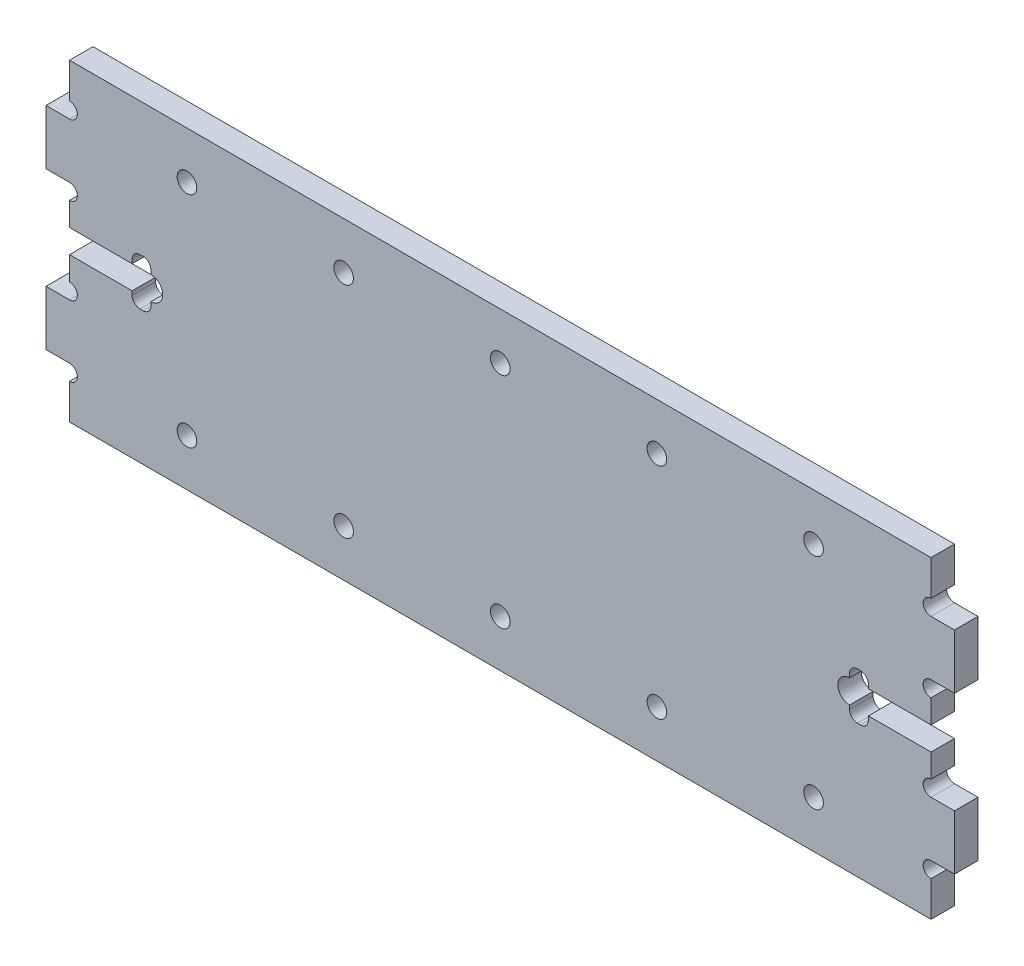
from build123d import *

# Parameters (mm, degrees)
SKETCH1_W           = 110
SKETCH1_H           = 40
BOSS_EXTRUDE1_DEPTH = 3
BOSS_EXTRUDE2_DEPTH = 3
CUT_EXTRUDE1_DEPTH  = 3
CUT_EXTRUDE2_DEPTH  = 3
FILLET6_R           = 1
SKETCH6_R           = 1.25
CUT_EXTRUDE4_DEPTH  = 62.424750712


with BuildPart() as part:
    # Sketch1 → Boss-Extrude1 (new body)
    with BuildSketch(Plane.XY):
        Rectangle(SKETCH1_W, SKETCH1_H)
    extrude(amount=BOSS_EXTRUDE1_DEPTH)

    # Sketch2 → Boss-Extrude2 (add)
    with BuildSketch(Plane.XY.offset(3)):
        Polygon((58, 10), (58, 13.5), (55, 13.5), (55, 6.5), (58, 6.5), align=None)
        Polygon((55, -10), (55, -6.5), (58, -6.5), (58, -13.5), (55, -13.5), align=None)
        Polygon((-55, 6.5), (-55, 13.5), (-58, 13.5), (-58, 10), (-58, 6.5), align=None)
        Polygon((-55, -13.5), (-55, -10), (-55, -6.5), (-58, -6.5), (-58, -13.5), align=None)
    extrude(amount=-BOSS_EXTRUDE2_DEPTH)

    # Sketch3 → Cut-Extrude1 (cut)
    with BuildSketch(Plane.XY.offset(3)):
        with BuildLine():
            Line((-55, 15.5), (-55, 13.5))
            ThreePointArc((-55, 13.5), (-54, 14.5), (-55, 15.5))
        make_face()
        with BuildLine():
            ThreePointArc((-55, 4.5), (-54, 5.5), (-55, 6.5))
            Line((-55, 6.5), (-55, 4.5))
        make_face()
        with BuildLine():
            ThreePointArc((-55, -6.5), (-54, -5.5), (-55, -4.5))
            Line((-55, -4.5), (-55, -6.5))
        make_face()
        with BuildLine():
            ThreePointArc((-55, -15.5), (-54, -14.5), (-55, -13.5))
            Line((-55, -13.5), (-55, -15.5))
        make_face()
        with BuildLine():
            ThreePointArc((55, 15.5), (54, 14.5), (55, 13.5))
            Line((55, 13.5), (55, 15.5))
        make_face()
        with BuildLine():
            Line((55, -6.5), (55, -4.5))
            ThreePointArc((55, -4.5), (54, -5.5), (55, -6.5))
        make_face()
        with BuildLine():
            Line((55, 4.5), (55, 6.5))
            ThreePointArc((55, 6.5), (54, 5.5), (55, 4.5))
        make_face()
        with BuildLine():
            Line((55, -15.5), (55, -13.5))
            ThreePointArc((55, -13.5), (54, -14.5), (55, -15.5))
        make_face()
    extrude(amount=-CUT_EXTRUDE1_DEPTH, mode=Mode.SUBTRACT)

    # Sketch4 → Cut-Extrude2 (cut)
    with BuildSketch(Plane.XY.offset(3)):
        with BuildLine():
            Line((-47, 1.5), (-55, 1.5))
            Line((-55, 1.5), (-55, -1.5))
            Line((-55, -1.5), (-47, -1.5))
            Line((-47, -1.5), (-47, -3))
            Line((-47, -3), (-44.6, -3))
            Line((-44.6, -3), (-44.6, -1.5))
            ThreePointArc((-44.6, -1.5), (-43.1, 0), (-44.6, 1.5))
            Line((-44.6, 1.5), (-44.6, 3))
            Line((-44.6, 3), (-47, 3))
            Line((-47, 3), (-47, 1.5))
        make_face()
        with BuildLine():
            Line((47, 3), (44.6, 3))
            Line((44.6, 3), (44.6, 1.5))
            ThreePointArc((44.6, 1.5), (43.1, 0), (44.6, -1.5))
            Line((44.6, -1.5), (44.6, -3))
            Line((44.6, -3), (47, -3))
            Line((47, -3), (47, -1.5))
            Line((47, -1.5), (55, -1.5))
            Line((55, -1.5), (55, 1.5))
            Line((55, 1.5), (47, 1.5))
            Line((47, 1.5), (47, 3))
        make_face()
    extrude(amount=-CUT_EXTRUDE2_DEPTH, mode=Mode.SUBTRACT)

    # Fillet6
    fillet6_edges = [part.edges().sort_by_distance(p)[0] for p in [
        (-44.6, 3, 1.5),
        (-47, 3, 1.5),
        (-44.6, -3, 1.5),
        (-47, -3, 1.5),
        (47, 3, 1.5),
        (44.6, 3, 1.5),
        (47, -3, 1.5),
        (44.6, -3, 1.5),
    ]]
    fillet(fillet6_edges, radius=FILLET6_R)

    # Sketch6 → Cut-Extrude4 (cut, through all)
    with BuildSketch(Plane.XY.offset(3)):
        with Locations((0, 14)):
            Circle(SKETCH6_R)
        with Locations((0, -14)):
            Circle(SKETCH6_R)
        with Locations((20, -14)):
            Circle(SKETCH6_R)
        with Locations((20, 14)):
            Circle(SKETCH6_R)
        with Locations((40, -14)):
            Circle(SKETCH6_R)
        with Locations((40, 14)):
            Circle(SKETCH6_R)
        with Locations((-20, -14)):
            Circle(SKETCH6_R)
        with Locations((-20, 14)):
            Circle(SKETCH6_R)
        with Locations((-40, -14)):
            Circle(SKETCH6_R)
        with Locations((-40, 14)):
            Circle(SKETCH6_R)
    extrude(amount=-CUT_EXTRUDE4_DEPTH, mode=Mode.SUBTRACT)


solid = part.part
